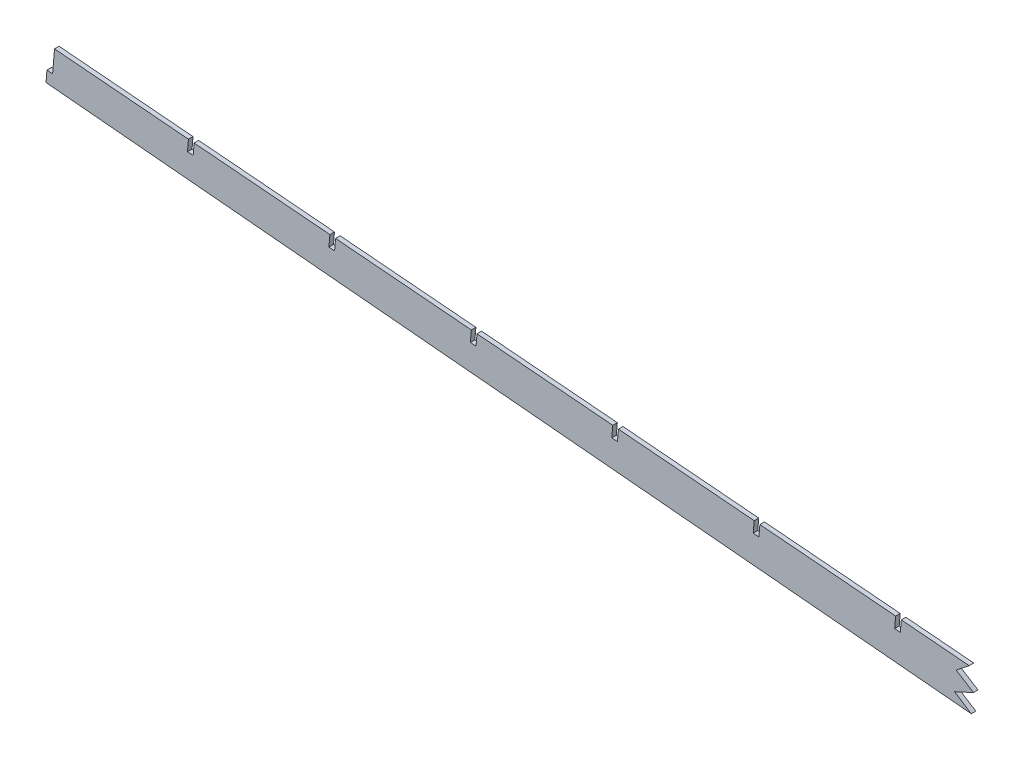
from build123d import *

# Parameters (mm, degrees)
BOSS_EXTRUDE1_DEPTH     = 2.54
CUT_EXTRUDE1_DEPTH      = 955.775766948
CUT_EXTRUDE1_DEPTH_BACK = 955.775766948
CUT_EXTRUDE2_DEPTH      = 7.62


with BuildPart() as part:
    # Sketch1 → Boss-Extrude1 (new body)
    with BuildSketch(Plane.XY):
        Polygon((-945.957227657, 86.137779906), (-945.969713578, 86.1172966), (-949.121092485, 86.403457059), (-949.65244679, 80.075727402), (-9.887238192, -5.25964904), (-6.723373364, -5.525326193), (0, -5.833733414), (152.4, -5.833733414), (152.4, 11.946266586), (139.7, 11.946266586), (139.7, 6.866266586), (136.525, 6.866266586), (136.525, 11.946266586), (95.25, 11.946266586), (95.25, 6.866266586), (92.075, 6.866266586), (92.075, 11.946266586), (79.375, 11.946266586), (79.375, 6.866266586), (76.2, 6.866266586), (76.2, 11.946266586), (69.85, 11.946266586), (25.4, 19.566266586), (19.05, 19.566266586), (19.05, 14.486266586), (15.875, 14.486266586), (15.875, 19.566266586), (3.175, 19.566266586), (3.175, 13.216266586), (0, 13.216266586), (0, 19.566266586), (-1.98607431, 19.566266586), (-4.597956143, 19.785592432), (-5.129310448, 13.457862776), (-8.293175277, 13.723539928), (-7.761820971, 20.051269584), (-944.89858306, 98.744842179), align=None)
    extrude(amount=BOSS_EXTRUDE1_DEPTH)

    # Sketch2 → Cut-Extrude1 (cut, two sides: drawn at the far end of the back side and taken through both)
    with BuildSketch(Plane.XY.offset(2.54).offset(-CUT_EXTRUDE1_DEPTH_BACK)):
        Polygon((-77.240292597, 25.885539855), (-80.404157425, 26.151217008), (-80.935453586, 19.824179771), (-77.77159129, 19.55847246), align=None)
        Polygon((-156.741594191, 26.190526923), (-156.210358707, 32.516841584), (-159.374223535, 32.782518736), (-159.905456487, 26.456234233), align=None)
        Polygon((-235.711597092, 32.822581386), (-235.180424816, 39.148143312), (-238.344289645, 39.413820465), (-238.875459388, 33.088288696), align=None)
        Polygon((-314.681599993, 39.454635849), (-314.150490926, 45.77944504), (-317.314355754, 46.045122193), (-317.845462289, 39.720343159), align=None)
        Polygon((-393.651602894, 46.086690311), (-393.120557036, 52.410746769), (-396.284421864, 52.676423921), (-396.81546519, 46.352397622), align=None)
        Polygon((-472.621605795, 52.718744774), (-472.090623146, 59.042048497), (-475.254487974, 59.30772565), (-475.785468091, 52.984452084), align=None)
        Polygon((-551.591608696, 59.350799237), (-551.060689256, 65.673350226), (-554.224554084, 65.939027378), (-554.755470992, 59.616506547), align=None)
        Polygon((-630.561611597, 65.9828537), (-630.030755365, 72.304651954), (-633.194620194, 72.570329107), (-633.725473893, 66.24856101), align=None)
        Polygon((-709.531614498, 72.614908162), (-709.000821475, 78.935953682), (-712.164686303, 79.201630835), (-712.695476794, 72.880615473), align=None)
        Polygon((-788.501617399, 79.246962625), (-787.970887585, 85.567255411), (-791.134752413, 85.832932563), (-791.665479694, 79.512669935), align=None)
        Polygon((-867.4716203, 85.879017088), (-866.940953695, 92.198557139), (-870.104818523, 92.464234292), (-870.635482595, 86.144724398), align=None)
    extrude(amount=CUT_EXTRUDE1_DEPTH + CUT_EXTRUDE1_DEPTH_BACK, mode=Mode.SUBTRACT)

    # Sketch3 → Cut-Extrude2 (cut)
    with BuildSketch(Plane.XY.offset(2.54)):
        Polygon((-434.187522505, 55.859236209), (-441.444486836, 50.074133547), (-431.803024179, 44.022577198), (-442.349656028, 39.171455119), (-433.014300591, 33.162402364), (148.326621663, -67.648294025), (201.247452175, 33.162402364), align=None)
    extrude(amount=-CUT_EXTRUDE2_DEPTH, mode=Mode.SUBTRACT)


solid = part.part
